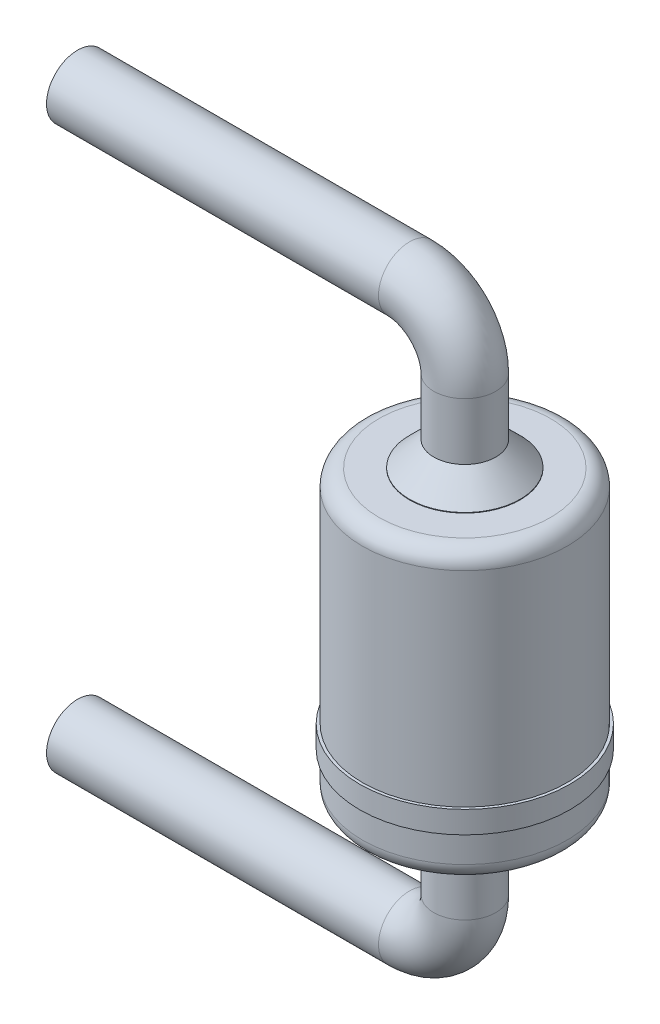
from build123d import *

# Parameters (mm, degrees)
SKETCH1_R               = 0.925
BOSS_EXTRUDE1_DEPTH     = 2.6
SKETCH2_R               = 0.5
BOSS_EXTRUDE2_DEPTH     = 0.225
CHAMFER2_SIZE           = 0.22
FILLET1_R               = 0.15
FILLET2_R               = 0.15
SKETCH10_R              = 0.95
SKETCH10_R_2            = 0.9
BOSS_EXTRUDE9_DEPTH     = 0.2
BARRER2_OUTLINE_R       = 0.28
BARRER2_ANGLE           = 90
BARRER2_START           = 2.825
BARRER2_2_OUTLINE_R     = 0.28
BARRER2_2_DEPTH         = 0.5150001
BARRER2_START_2         = -3.5
BARRER2_3_OUTLINE_R     = 0.28
BARRER2_3_DEPTH         = 3.0000001
CROQUIS7_R              = 0.5
SALIENTE_EXTRUIR1_DEPTH = 0.225
CHAFL_N1_SIZE           = 0.22
BARRER3_OUTLINE_R       = 0.28
BARRER3_ANGLE           = 90
BARRER3_START           = -0.7400001
BARRER3_2_OUTLINE_R     = 0.28
BARRER3_2_DEPTH         = 1.7400001
BARRER3_START_2         = -3.5
BARRER3_3_OUTLINE_R     = 0.28
BARRER3_3_DEPTH         = 3.0000001


with BuildPart() as part:
    # Sketch1 → Boss-Extrude1 (new body)
    with BuildSketch(Plane(origin=(0, 0, 0), x_dir=(1, 0, 0), z_dir=(0, 1, 0))):
        with Locations(Location((0, 0, 0), (0, 0, 270))):
            Circle(SKETCH1_R)
    extrude(amount=BOSS_EXTRUDE1_DEPTH)

    # Fillet1
    fillet1_edges = [part.edges().sort_by_distance(p)[0] for p in [
        (0, 2.6, -0.925),
    ]]
    fillet(fillet1_edges, radius=FILLET1_R)

    # Fillet2
    fillet2_edges = [part.edges().sort_by_distance(p)[0] for p in [
        (0, 0, -0.925),
    ]]
    fillet(fillet2_edges, radius=FILLET2_R)

    # Croquis7 → Saliente-Extruir1 (add)
    with BuildSketch(Plane.XZ):
        with Locations(Location((0, 0, 0), (0, 0, 90))):
            Circle(CROQUIS7_R)
    extrude(amount=SALIENTE_EXTRUIR1_DEPTH)

    # Chaflán1
    chafl_n1_edges = [part.edges().sort_by_distance(p)[0] for p in [
        (0, -0.225, -0.5),
    ]]
    chamfer(chafl_n1_edges, length=CHAFL_N1_SIZE)

    # Barrer3: read off the stored shape, not the designer's step
    # Barrer3 outline → Barrer3 (revolve)
    with BuildSketch(Plane(origin=(-0.5, -0.74, 0), x_dir=(0, -1, 0), z_dir=(-1, 0, 0))):
        with Locations((0.5, 0)):
            Circle(BARRER3_OUTLINE_R)
    revolve(axis=Axis((-0.5, -0.74, 0), (0, 0, 1)), revolution_arc=BARRER3_ANGLE)

    # Barrer3 2 outline → Barrer3 2 (add)
    with BuildSketch(Plane(origin=(0, 0, 0), x_dir=(1, 0, 0), z_dir=(0, 1, 0)).offset(BARRER3_START)):
        Circle(BARRER3_2_OUTLINE_R)
    extrude(amount=BARRER3_2_DEPTH)

    # Barrer3 3 outline → Barrer3 3 (add)
    with BuildSketch(Plane.YZ.offset(BARRER3_START_2)):
        with Locations((-1.24, 0)):
            Circle(BARRER3_3_OUTLINE_R)
    extrude(amount=BARRER3_3_DEPTH)


with BuildPart() as body_2:
    # Sketch2 → Boss-Extrude2 (new body)
    with BuildSketch(Plane(origin=(0, 2.6, 0), x_dir=(1, 0, 0), z_dir=(0, 1, 0))):
        with Locations(Location((0, 0, 0), (0, 0, 270))):
            Circle(SKETCH2_R)
    extrude(amount=BOSS_EXTRUDE2_DEPTH)

    # Chamfer2
    chamfer2_edges = [body_2.edges().sort_by_distance(p)[0] for p in [
        (0, 2.825, -0.5),
    ]]
    chamfer(chamfer2_edges, length=CHAMFER2_SIZE)

    # Barrer2: read off the stored shape, not the designer's step
    # Barrer2 outline → Barrer2 (revolve)
    with BuildSketch(Plane(origin=(-0.5, 3.34, 0), x_dir=(1, 0, 0), z_dir=(0, -1, 0))):
        with Locations((0.5, 0)):
            Circle(BARRER2_OUTLINE_R)
    revolve(axis=Axis((-0.5, 3.34, 0), (0, 0, 1)), revolution_arc=BARRER2_ANGLE)

    # Barrer2 2 outline → Barrer2 2 (add)
    with BuildSketch(Plane(origin=(0, 0, 0), x_dir=(1, 0, 0), z_dir=(0, 1, 0)).offset(BARRER2_START)):
        Circle(BARRER2_2_OUTLINE_R)
    extrude(amount=BARRER2_2_DEPTH)

    # Barrer2 3 outline → Barrer2 3 (add)
    with BuildSketch(Plane.YZ.offset(BARRER2_START_2)):
        with Locations((3.84, 0)):
            Circle(BARRER2_3_OUTLINE_R)
    extrude(amount=BARRER2_3_DEPTH)


with BuildPart() as body_3:
    # Sketch10 → Boss-Extrude9 (new body)
    with BuildSketch(Plane(origin=(0, 0.6, 0), x_dir=(-1, 0, 0), z_dir=(0, 1, 0))):
        with Locations(Location((0, 0, 0), (0, 0, 90))):
            Circle(SKETCH10_R)
        with Locations(Location((0, 0, 0), (0, 0, 90))):
            Circle(SKETCH10_R_2, mode=Mode.SUBTRACT)
    extrude(amount=-BOSS_EXTRUDE9_DEPTH)


solid = Compound([part.part, body_2.part, body_3.part])
